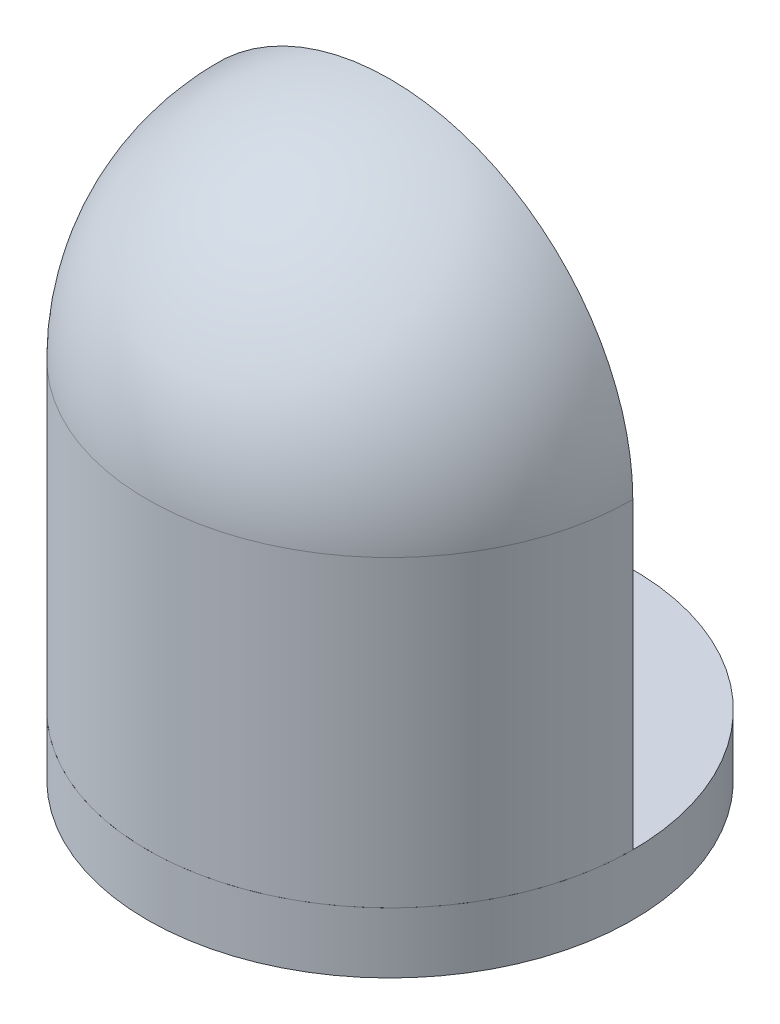
from build123d import *

# Parameters (mm, degrees)
SKETCH_1_R      = 40
EXTRUDE_1_DEPTH = 10
REVOLVE_1_ANGLE = 180


with BuildPart() as part:
    # 草图1 → 凸台-拉伸1 (new body)
    with BuildSketch(Plane(origin=(0, 0, 0), x_dir=(1, 0, 0), z_dir=(0, 1, 0))):
        Circle(SKETCH_1_R)
    extrude(amount=EXTRUDE_1_DEPTH)


with BuildPart() as body_2:
    # 草图2 → 旋转1 (revolve)
    with BuildSketch(Plane.XY):
        with BuildLine():
            ThreePointArc((40, 60), (28.284271247, 88.284271247), (0, 100))
            Line((0, 100), (0, 10))
            Line((0, 10), (40, 10))
            Line((40, 10), (40, 60))
        make_face()
    revolve(axis=Axis((0, 111.976558556, 0), (0, -1, 0)), revolution_arc=REVOLVE_1_ANGLE)


solid = Compound([part.part, body_2.part])
